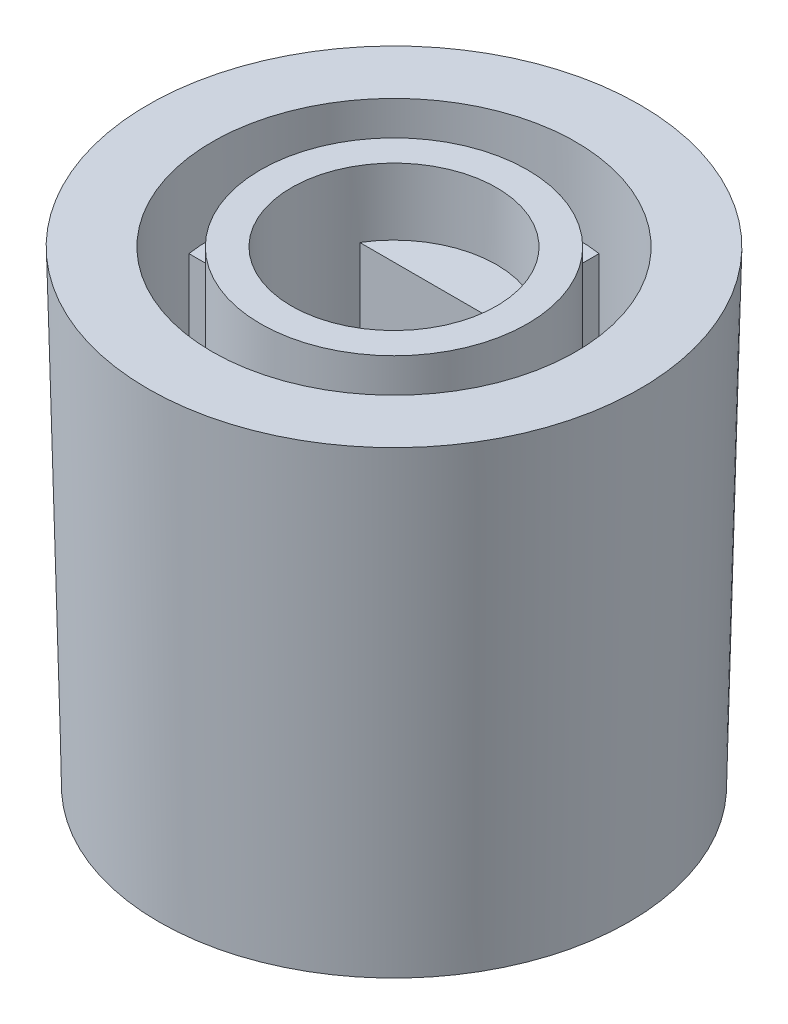
from build123d import *

# Parameters (mm, degrees)
SKETCH1_R           = 7.05
BOSS_EXTRUDE1_DEPTH = 3.5
SKETCH2_R           = 7.05
SKETCH2_R_2         = 5.45
BOSS_EXTRUDE2_DEPTH = 10.5
DRAFT1_ANGLE        = 1.325
SKETCH6_R           = 4
BOSS_EXTRUDE3_DEPTH = 10.5
CUT_EXTRUDE1_DEPTH  = 9
SKETCH7_R           = 3.075
CUT_EXTRUDE2_DEPTH  = 2
SKETCH8_W           = 2.525210291
SKETCH8_H           = 1.5
SKETCH8_W_2         = 2.122251202
SKETCH8_W_3         = 1.5
SKETCH8_H_2         = 2.337162717
SKETCH8_H_3         = 2.758031098
BOSS_EXTRUDE4_DEPTH = 8


with BuildPart() as part:
    # Sketch1 → Boss-Extrude1 (new body)
    with BuildSketch(Plane(origin=(0, 0, 0), x_dir=(1, 0, 0), z_dir=(0, 1, 0))):
        Circle(SKETCH1_R)
    extrude(amount=BOSS_EXTRUDE1_DEPTH)

    # Sketch2 → Boss-Extrude2 (add)
    with BuildSketch(Plane(origin=(0, 3.5, 0), x_dir=(1, 0, 0), z_dir=(0, 1, 0))):
        Circle(SKETCH2_R)
        Circle(SKETCH2_R_2, mode=Mode.SUBTRACT)
    extrude(amount=BOSS_EXTRUDE2_DEPTH)

    # Draft1
    draft1_faces = [part.faces().sort_by_distance(p)[0] for p in [
        (-7.05, 7, 0),
    ]]
    draft(draft1_faces, Plane(origin=(0, 0, 0), x_dir=(0, 0, -1), z_dir=(0, -1, 0)), DRAFT1_ANGLE)

    # Sketch6 → Boss-Extrude3 (add)
    with BuildSketch(Plane(origin=(0, 3.5, 0), x_dir=(1, 0, 0), z_dir=(0, 1, 0))):
        Circle(SKETCH6_R)
    extrude(amount=BOSS_EXTRUDE3_DEPTH)

    # Sketch5 → Cut-Extrude1 (cut)
    with BuildSketch(Plane(origin=(0, 14, 0), x_dir=(1, 0, 0), z_dir=(0, 1, 0))):
        with BuildLine():
            Line((2.625952208, 1.6), (-2.625952208, 1.6))
            ThreePointArc((-2.625952208, 1.6), (-0.83090973, -2.960610413), (3.075, 0))
            ThreePointArc((3.075, 0), (2.960610413, 0.83090973), (2.625952208, 1.6))
        make_face()
    extrude(amount=-CUT_EXTRUDE1_DEPTH, mode=Mode.SUBTRACT)

    # Sketch7 → Cut-Extrude2 (cut)
    with BuildSketch(Plane(origin=(0, 14, 0), x_dir=(1, 0, 0), z_dir=(0, 1, 0))):
        Circle(SKETCH7_R)
    extrude(amount=-CUT_EXTRUDE2_DEPTH, mode=Mode.SUBTRACT)

    # Sketch8 → Boss-Extrude4 (add)
    with BuildSketch(Plane(origin=(0, 3.5, 0), x_dir=(1, 0, 0), z_dir=(0, 1, 0))):
        with Locations((-4.853418362, 0)):
            Rectangle(SKETCH8_W, SKETCH8_H)
        with Locations((4.696712049, 0)):
            Rectangle(SKETCH8_W_2, SKETCH8_H)
        with Locations((0, 4.745962605)):
            Rectangle(SKETCH8_W_3, SKETCH8_H_2)
        with Locations((0, -4.822077099)):
            Rectangle(SKETCH8_W_3, SKETCH8_H_3)
    extrude(amount=BOSS_EXTRUDE4_DEPTH)


solid = part.part
